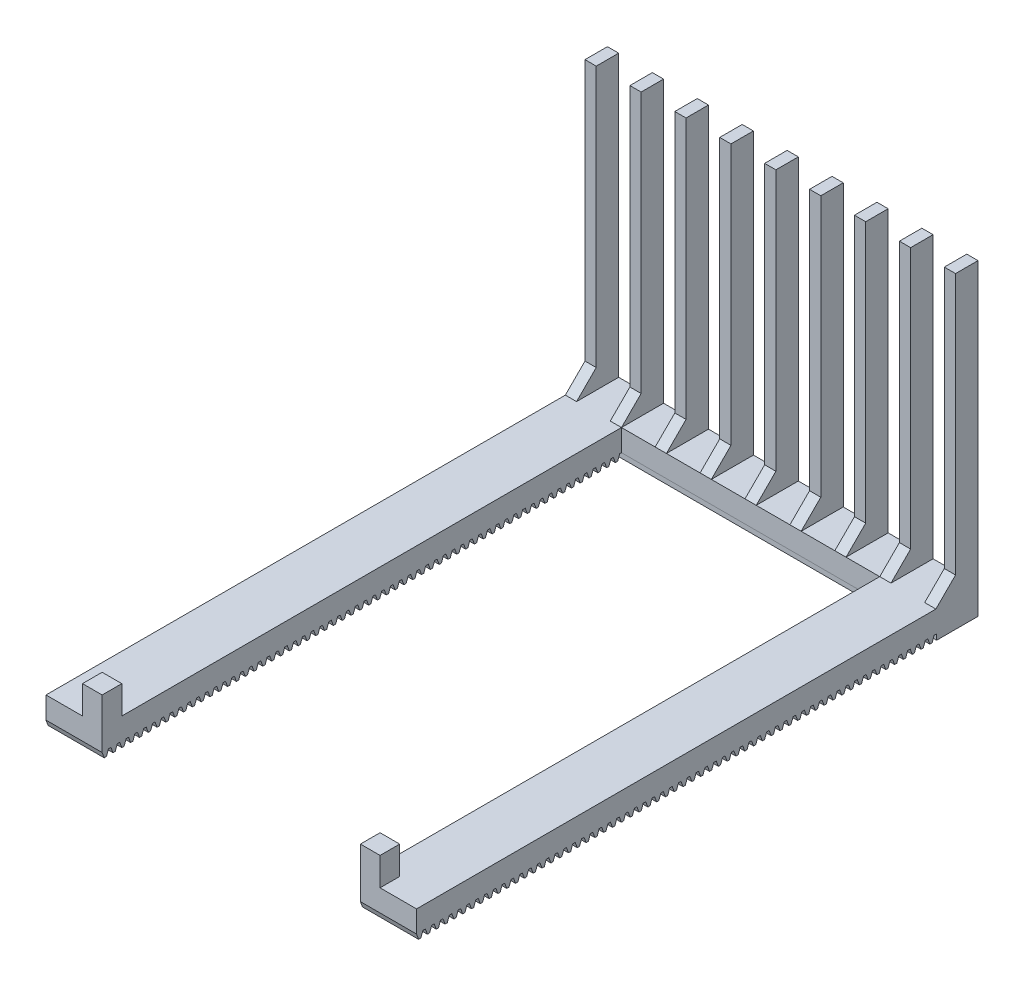
from build123d import *

# Parameters (mm, degrees)
BOSS_EXTRUDE1_DEPTH = 9.76
SKETCH2_W           = 4
SKETCH2_H           = 8
BOSS_EXTRUDE2_DEPTH = 100
CHAMFER1_SIZE       = 7
LPATTERN1_START     = -134.063385601
LPATTERN1_DEPTH     = 4
LPATTERN1_START_2   = -118.063385601
LPATTERN1_2_DEPTH   = 4
LPATTERN1_START_3   = -102.063385601
LPATTERN1_3_DEPTH   = 4
LPATTERN1_START_4   = -86.063385601
LPATTERN1_4_DEPTH   = 4
LPATTERN1_START_5   = -70.063385601
LPATTERN1_5_DEPTH   = 4
LPATTERN1_START_6   = -54.063385601
LPATTERN1_6_DEPTH   = 4
LPATTERN1_START_7   = -38.063385601
LPATTERN1_7_DEPTH   = 4
LPATTERN1_START_8   = -22.063385601
LPATTERN1_8_DEPTH   = 4
CUT_EXTRUDE1_DEPTH  = 204.439774701
LPATTERN2_COUNT     = 59
LPATTERN2_PITCH     = 3.14
SKETCH8_W           = 7
SKETCH8_H           = 7
BOSS_EXTRUDE3_DEPTH = 10


# Read off the part's stored shape, not the designer's step: LPattern1
with BuildPart() as part:
    # Sketch1 → Boss-Extrude1 (new body)
    with BuildSketch(Plane(origin=(0, 0, 0), x_dir=(1, 0, 0), z_dir=(0, 1, 0))):
        Polygon((-150.063385601, -109.162650804), (-150.063385601, 90.837349196), (-18.063385601, 90.837349196), (-18.063385601, -109.162650804), (-38.063385601, -109.162650804), (-38.063385601, 75.837349196), (-130.063385601, 75.837349196), (-130.063385601, -109.162650804), align=None)
    extrude(amount=BOSS_EXTRUDE1_DEPTH)

    # Sketch2 → Boss-Extrude2 (add)
    with BuildSketch(Plane(origin=(0, 9.76, 0), x_dir=(1, 0, 0), z_dir=(0, 1, 0))):
        with Locations((-148.063385601, 86.837349196)):
            Rectangle(SKETCH2_W, SKETCH2_H)
    extrude(amount=BOSS_EXTRUDE2_DEPTH)

    # Chamfer1
    chamfer1_edges = [part.edges().sort_by_distance(p)[0] for p in [
        (-148.063385601, 9.76, -82.837349196),
    ]]
    chamfer(chamfer1_edges, length=CHAMFER1_SIZE)

    # LPattern1 outline → LPattern1 (add)
    with BuildSketch(Plane.YZ.offset(LPATTERN1_START)):
        Polygon((9.76, -90.837349196), (109.76, -90.837349196), (109.76, -82.837349196), (16.76, -82.837349196), (9.76, -75.837349196), align=None)
    extrude(amount=LPATTERN1_DEPTH)

    # LPattern1 2 outline → LPattern1 2 (add)
    with BuildSketch(Plane.YZ.offset(LPATTERN1_START_2)):
        Polygon((9.76, -90.837349196), (109.76, -90.837349196), (109.76, -82.837349196), (16.76, -82.837349196), (9.76, -75.837349196), align=None)
    extrude(amount=LPATTERN1_2_DEPTH)

    # LPattern1 3 outline → LPattern1 3 (add)
    with BuildSketch(Plane.YZ.offset(LPATTERN1_START_3)):
        Polygon((9.76, -90.837349196), (109.76, -90.837349196), (109.76, -82.837349196), (16.76, -82.837349196), (9.76, -75.837349196), align=None)
    extrude(amount=LPATTERN1_3_DEPTH)

    # LPattern1 4 outline → LPattern1 4 (add)
    with BuildSketch(Plane.YZ.offset(LPATTERN1_START_4)):
        Polygon((9.76, -90.837349196), (109.76, -90.837349196), (109.76, -82.837349196), (16.76, -82.837349196), (9.76, -75.837349196), align=None)
    extrude(amount=LPATTERN1_4_DEPTH)

    # LPattern1 5 outline → LPattern1 5 (add)
    with BuildSketch(Plane.YZ.offset(LPATTERN1_START_5)):
        Polygon((9.76, -90.837349196), (109.76, -90.837349196), (109.76, -82.837349196), (16.76, -82.837349196), (9.76, -75.837349196), align=None)
    extrude(amount=LPATTERN1_5_DEPTH)

    # LPattern1 6 outline → LPattern1 6 (add)
    with BuildSketch(Plane.YZ.offset(LPATTERN1_START_6)):
        Polygon((9.76, -90.837349196), (109.76, -90.837349196), (109.76, -82.837349196), (16.76, -82.837349196), (9.76, -75.837349196), align=None)
    extrude(amount=LPATTERN1_6_DEPTH)

    # LPattern1 7 outline → LPattern1 7 (add)
    with BuildSketch(Plane.YZ.offset(LPATTERN1_START_7)):
        Polygon((9.76, -90.837349196), (109.76, -90.837349196), (109.76, -82.837349196), (16.76, -82.837349196), (9.76, -75.837349196), align=None)
    extrude(amount=LPATTERN1_7_DEPTH)

    # LPattern1 8 outline → LPattern1 8 (add)
    with BuildSketch(Plane.YZ.offset(LPATTERN1_START_8)):
        Polygon((9.76, -90.837349196), (109.76, -90.837349196), (109.76, -82.837349196), (16.76, -82.837349196), (9.76, -75.837349196), align=None)
    extrude(amount=LPATTERN1_8_DEPTH)

    # Sketch7 → Cut-Extrude1 (cut, through all)
    with BuildSketch(Plane(origin=(-18.063385601, 0, 0), x_dir=(0, 0, -1), z_dir=(1, 0, 0))):
        Polygon((-106.021150804, 2), (-106.906769867, 2), (-107.634710335, 0), (-106.021150804, 0), align=None)
        Polygon((-108.434710335, 0), (-109.162650804, 2), (-109.162650804, 0), align=None)
    cut_extrude1 = extrude(amount=-CUT_EXTRUDE1_DEPTH, mode=Mode.SUBTRACT)

    # LPattern2: Cut-Extrude1 ×59
    with Locations(*[(0, 0, -i * LPATTERN2_PITCH) for i in range(1, LPATTERN2_COUNT)]):
        add(cut_extrude1, mode=Mode.SUBTRACT)

    # Sketch8 → Boss-Extrude3 (add)
    with BuildSketch(Plane(origin=(0, 9.76, 0), x_dir=(1, 0, 0), z_dir=(0, 1, 0))):
        with Locations((-133.563385601, -105.662650804)):
            Rectangle(SKETCH8_W, SKETCH8_H)
        with Locations((-34.563385601, -105.662650804)):
            Rectangle(SKETCH8_W, SKETCH8_H)
    extrude(amount=BOSS_EXTRUDE3_DEPTH)


solid = part.part
